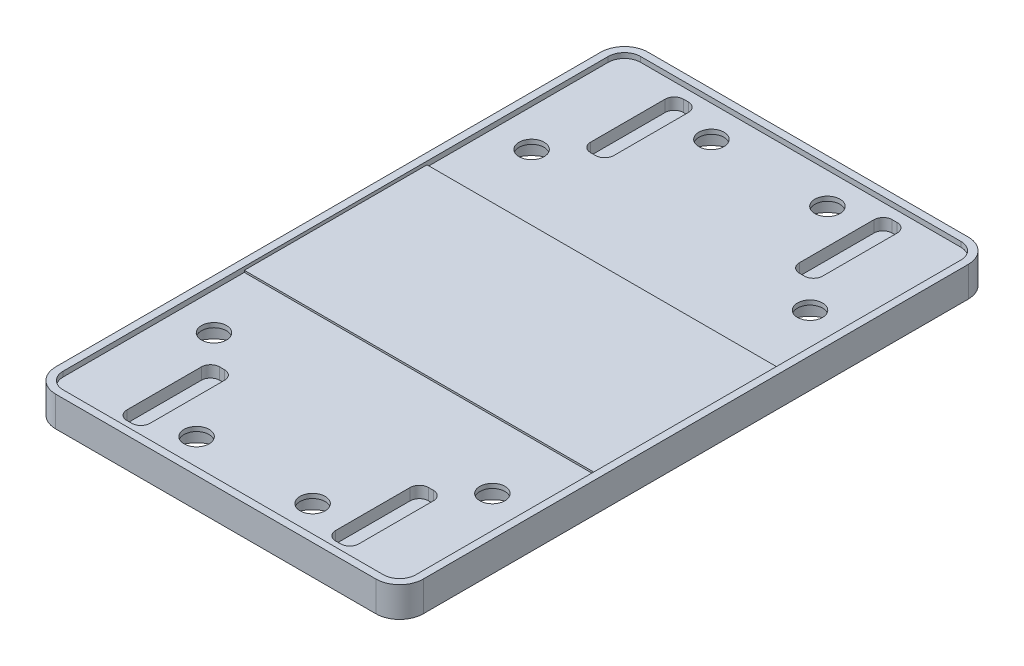
from build123d import *

# Parameters (mm, degrees)
SKETCH1_W             = 40.2336
SKETCH1_H             = 22.0218
BOSS_EXTRUDE1_DEPTH   = 3.3
FILLET1_R             = 2.5908
SKETCH3_W             = 38.608
SKETCH3_H             = 21.209
CUT_EXTRUDE1_DEPTH    = 0.5588
FILLET2_R             = 1.778
SKETCH4_R             = 1.375
CUT_EXTRUDE2_DEPTH    = 24.096314392
SKETCH5_R             = 3.045
CUT_EXTRUDE3_DEPTH    = 2.25
SKETCH6_W             = 2.54
SKETCH6_H             = 10.16
CUT_EXTRUDE4_DEPTH    = 1.27
FILLET3_R             = 1
FILLET3_OF_MIRROR3_R  = 1
BOSS_EXTRUDE2_DEPTH   = 20.8
SKETCH9_W             = 38.608
SKETCH9_H             = 20
BOSS_EXTRUDE3_DEPTH   = 0.2
MIRROR4_OUTLINE_R     = 3.045
MIRROR4_DEPTH         = 2.7412
MIRROR4_2_DEPTH       = 1.4712
MIRROR4_START         = 2.25
MIRROR4_3_OUTLINE_R   = 3.045
MIRROR4_3_OUTLINE_R_2 = 1.375
MIRROR4_3_DEPTH       = 0.4912
MIRROR4_START_2       = 2.7412
MIRROR4_4_DEPTH       = 0.5588


# Read off the part's stored shape, not the designer's step: Mirror4
with BuildPart() as part:
    # Sketch1 → Boss-Extrude1 (new body)
    with BuildSketch(Plane(origin=(0, 0, 0), x_dir=(1, 0, 0), z_dir=(0, 1, 0))):
        Rectangle(SKETCH1_W, SKETCH1_H)
    extrude(amount=BOSS_EXTRUDE1_DEPTH)

    # Fillet1
    fillet1_edges = [part.edges().sort_by_distance(p)[0] for p in [
        (-20.1168, 1.65, -11.0109),
        (20.1168, 1.65, -11.0109),
    ]]
    fillet(fillet1_edges, radius=FILLET1_R)

    # Sketch3 → Cut-Extrude1 (cut)
    with BuildSketch(Plane(origin=(0, 3.3, 0), x_dir=(1, 0, 0), z_dir=(0, 1, 0))):
        with Locations((0, -0.4064)):
            Rectangle(SKETCH3_W, SKETCH3_H)
    extrude(amount=-CUT_EXTRUDE1_DEPTH, mode=Mode.SUBTRACT)

    # Fillet2
    fillet2_edges = [part.edges().sort_by_distance(p)[0] for p in [
        (19.304, 3.0206, -10.1981),
        (-19.304, 3.0206, -10.1981),
    ]]
    fillet(fillet2_edges, radius=FILLET2_R)

    # Sketch4 → Cut-Extrude2 (cut, through all)
    with BuildSketch(Plane(origin=(0, 2.7412, 0), x_dir=(1, 0, 0), z_dir=(0, 1, 0))):
        with Locations(Location((-6.35, 6.7691, 0), (0, 0, 270))):
            Circle(SKETCH4_R)
        with Locations(Location((-15.24, -4.0259, 0), (0, 0, 270))):
            Circle(SKETCH4_R)
    cut_extrude2 = extrude(amount=-CUT_EXTRUDE2_DEPTH, mode=Mode.SUBTRACT)

    # Mirror1: Cut-Extrude2 across plane
    add(cut_extrude2.mirror(Plane(origin=(0, 0, 0), x_dir=(0, 0, 1), z_dir=(1, 0, 0))), mode=Mode.SUBTRACT)

    # Sketch5 → Cut-Extrude3 (cut)
    with BuildSketch(Plane.XZ):
        with Locations(Location((-15.24, 4.0259, 0), (0, 0, 270))):
            Circle(SKETCH5_R)
        with Locations(Location((-6.35, -6.7691, 0), (0, 0, 270))):
            Circle(SKETCH5_R)
    cut_extrude3 = extrude(amount=-CUT_EXTRUDE3_DEPTH, mode=Mode.SUBTRACT)

    # Mirror2: Cut-Extrude3 across plane
    add(cut_extrude3.mirror(Plane(origin=(0, 0, 0), x_dir=(0, 0, 1), z_dir=(1, 0, 0))), mode=Mode.SUBTRACT)

    # Sketch6 → Cut-Extrude4 (cut)
    with BuildSketch(Plane(origin=(0, 2.7412, 0), x_dir=(1, 0, 0), z_dir=(0, 1, 0))):
        with Locations((-11.43, 3.9751)):
            Rectangle(SKETCH6_W, SKETCH6_H)
    cut_extrude4 = extrude(amount=-CUT_EXTRUDE4_DEPTH, mode=Mode.SUBTRACT)

    # Fillet3
    fillet3_edges = [part.edges().sort_by_distance(p)[0] for p in [
        (-10.16, 2.1062, -9.0551),
        (-10.16, 2.1062, 1.1049),
        (-12.7, 2.1062, 1.1049),
        (-12.7, 2.1062, -9.0551),
    ]]
    fillet(fillet3_edges, radius=FILLET3_R)

    # Mirror3: Cut-Extrude4 across plane
    add(cut_extrude4.mirror(Plane(origin=(0, 0, 0), x_dir=(0, 0, 1), z_dir=(1, 0, 0))), mode=Mode.SUBTRACT)

    # Fillet3 of Mirror3
    fillet3_of_mirror3_edges = [part.edges().sort_by_distance(p)[0] for p in [
        (10.16, 2.1062, -9.0551),
        (10.16, 2.1062, 1.1049),
        (12.7, 2.1062, 1.1049),
        (12.7, 2.1062, -9.0551),
    ]]
    fillet(fillet3_of_mirror3_edges, radius=FILLET3_OF_MIRROR3_R)

    # Sketch8 → Boss-Extrude2 (add)
    with BuildSketch(Plane.XY.offset(11.0109)):
        Polygon((-20.1168, 0), (-20.1168, 3.3), (-19.304, 3.3), (-19.304, 2.7412), (19.304, 2.7412), (19.304, 3.3), (20.1168, 3.3), (20.1168, 0), align=None)
    extrude(amount=BOSS_EXTRUDE2_DEPTH)

    # Sketch9 → Boss-Extrude3 (add)
    with BuildSketch(Plane(origin=(0, 2.7412, 0), x_dir=(1, 0, 0), z_dir=(0, 1, 0))):
        with Locations((0, -21.4109)):
            Rectangle(SKETCH9_W, SKETCH9_H)
    extrude(amount=BOSS_EXTRUDE3_DEPTH)

    # Mirror4 outline → Mirror4 (add)
    with BuildSketch(Plane(origin=(0, 0, 0), x_dir=(1, 0, 0), z_dir=(0, 1, 0))):
        with BuildLine():
            Line((-20.1168, -31.8109), (-20.1168, -51.241899868))
            ThreePointArc((-20.1168, -51.241899868), (-19.357972249, -53.073872117), (-17.526, -53.832699868))
            Line((-17.526, -53.832699868), (17.526, -53.832699868))
            ThreePointArc((17.526, -53.832699868), (19.357972249, -53.073872117), (20.1168, -51.241899868))
            Line((20.1168, -51.241899868), (20.1168, -31.8109))
            Line((20.1168, -31.8109), (-20.1168, -31.8109))
        make_face()
        with Locations((-6.35, -49.590899868)):
            Circle(MIRROR4_OUTLINE_R, mode=Mode.SUBTRACT)
        with BuildLine():
            ThreePointArc((-11.16, -41.716899868), (-10.452893219, -42.009793087), (-10.16, -42.716899868))
            Line((-10.16, -42.716899868), (-10.16, -50.876899868))
            ThreePointArc((-10.16, -50.876899868), (-10.452893219, -51.584006649), (-11.16, -51.876899868))
            Line((-11.16, -51.876899868), (-11.7, -51.876899868))
            ThreePointArc((-11.7, -51.876899868), (-12.407106781, -51.584006649), (-12.7, -50.876899868))
            Line((-12.7, -50.876899868), (-12.7, -42.716899868))
            ThreePointArc((-12.7, -42.716899868), (-12.407106781, -42.009793087), (-11.7, -41.716899868))
            Line((-11.7, -41.716899868), (-11.16, -41.716899868))
        make_face(mode=Mode.SUBTRACT)
        with Locations((6.35, -49.590899868)):
            Circle(MIRROR4_OUTLINE_R, mode=Mode.SUBTRACT)
        with BuildLine():
            Line((10.16, -50.876899868), (10.16, -42.716899868))
            ThreePointArc((10.16, -42.716899868), (10.452893219, -42.009793087), (11.16, -41.716899868))
            Line((11.16, -41.716899868), (11.7, -41.716899868))
            ThreePointArc((11.7, -41.716899868), (12.407106781, -42.009793087), (12.7, -42.716899868))
            Line((12.7, -42.716899868), (12.7, -50.876899868))
            ThreePointArc((12.7, -50.876899868), (12.407106781, -51.584006649), (11.7, -51.876899868))
            Line((11.7, -51.876899868), (11.16, -51.876899868))
            ThreePointArc((11.16, -51.876899868), (10.452893219, -51.584006649), (10.16, -50.876899868))
        make_face(mode=Mode.SUBTRACT)
        with Locations((-15.24, -38.795899868)):
            Circle(MIRROR4_OUTLINE_R, mode=Mode.SUBTRACT)
        with Locations((15.24, -38.795899868)):
            Circle(MIRROR4_OUTLINE_R, mode=Mode.SUBTRACT)
    extrude(amount=MIRROR4_DEPTH)

    # Mirror4 2 outline → Mirror4 2 (add)
    with BuildSketch(Plane(origin=(0, 0, 0), x_dir=(1, 0, 0), z_dir=(0, 1, 0))):
        with BuildLine():
            Line((-10.16, -50.876899868), (-10.16, -42.716899868))
            ThreePointArc((-10.16, -42.716899868), (-10.452893219, -42.009793087), (-11.16, -41.716899868))
            Line((-11.16, -41.716899868), (-11.7, -41.716899868))
            ThreePointArc((-11.7, -41.716899868), (-12.407106781, -42.009793087), (-12.7, -42.716899868))
            Line((-12.7, -42.716899868), (-12.7, -50.876899868))
            ThreePointArc((-12.7, -50.876899868), (-12.407106781, -51.584006649), (-11.7, -51.876899868))
            Line((-11.7, -51.876899868), (-11.16, -51.876899868))
            ThreePointArc((-11.16, -51.876899868), (-10.452893219, -51.584006649), (-10.16, -50.876899868))
        make_face()
        with BuildLine():
            ThreePointArc((11.16, -41.716899868), (10.452893219, -42.009793087), (10.16, -42.716899868))
            Line((10.16, -42.716899868), (10.16, -50.876899868))
            ThreePointArc((10.16, -50.876899868), (10.452893219, -51.584006649), (11.16, -51.876899868))
            Line((11.16, -51.876899868), (11.7, -51.876899868))
            ThreePointArc((11.7, -51.876899868), (12.407106781, -51.584006649), (12.7, -50.876899868))
            Line((12.7, -50.876899868), (12.7, -42.716899868))
            ThreePointArc((12.7, -42.716899868), (12.407106781, -42.009793087), (11.7, -41.716899868))
            Line((11.7, -41.716899868), (11.16, -41.716899868))
        make_face()
    extrude(amount=MIRROR4_2_DEPTH)

    # Mirror4 3 outline → Mirror4 3 (add)
    # profile 1 of 4: a face of its own
    with BuildSketch(Plane(origin=(0, 0, 0), x_dir=(1, 0, 0), z_dir=(0, 1, 0)).offset(MIRROR4_START)):
        with Locations((-6.35, -49.590899868)):
            Circle(MIRROR4_3_OUTLINE_R)
        with Locations((-6.35, -49.590899868)):
            Circle(MIRROR4_3_OUTLINE_R_2, mode=Mode.SUBTRACT)
    # profile 2 of 4: a face of its own
    with BuildSketch(Plane(origin=(0, 0, 0), x_dir=(1, 0, 0), z_dir=(0, 1, 0)).offset(MIRROR4_START)):
        with Locations((-15.24, -38.795899868)):
            Circle(MIRROR4_3_OUTLINE_R)
        with Locations((-15.24, -38.795899868)):
            Circle(MIRROR4_3_OUTLINE_R_2, mode=Mode.SUBTRACT)
    # profile 3 of 4: a face of its own
    with BuildSketch(Plane(origin=(0, 0, 0), x_dir=(1, 0, 0), z_dir=(0, 1, 0)).offset(MIRROR4_START)):
        with Locations((6.35, -49.590899868)):
            Circle(MIRROR4_3_OUTLINE_R)
        with Locations((6.35, -49.590899868)):
            Circle(MIRROR4_3_OUTLINE_R_2, mode=Mode.SUBTRACT)
    # profile 4 of 4: a face of its own
    with BuildSketch(Plane(origin=(0, 0, 0), x_dir=(1, 0, 0), z_dir=(0, 1, 0)).offset(MIRROR4_START)):
        with Locations((15.24, -38.795899868)):
            Circle(MIRROR4_3_OUTLINE_R)
        with Locations((15.24, -38.795899868)):
            Circle(MIRROR4_3_OUTLINE_R_2, mode=Mode.SUBTRACT)
    extrude(amount=MIRROR4_3_DEPTH)

    # Mirror4 4 outline → Mirror4 4 (add)
    with BuildSketch(Plane(origin=(0, 0, 0), x_dir=(1, 0, 0), z_dir=(0, 1, 0)).offset(MIRROR4_START_2)):
        with BuildLine():
            Line((19.304, -31.8109), (19.304, -51.241899868))
            ThreePointArc((19.304, -51.241899868), (18.783235857, -52.499135725), (17.526, -53.019899868))
            Line((17.526, -53.019899868), (-17.526, -53.019899868))
            ThreePointArc((-17.526, -53.019899868), (-18.783235857, -52.499135725), (-19.304, -51.241899868))
            Line((-19.304, -51.241899868), (-19.304, -31.8109))
            Line((-19.304, -31.8109), (-20.1168, -31.8109))
            Line((-20.1168, -31.8109), (-20.1168, -51.241899868))
            ThreePointArc((-20.1168, -51.241899868), (-19.357972249, -53.073872117), (-17.526, -53.832699868))
            Line((-17.526, -53.832699868), (17.526, -53.832699868))
            ThreePointArc((17.526, -53.832699868), (19.357972249, -53.073872117), (20.1168, -51.241899868))
            Line((20.1168, -51.241899868), (20.1168, -31.8109))
            Line((20.1168, -31.8109), (19.304, -31.8109))
        make_face()
    extrude(amount=MIRROR4_4_DEPTH)


solid = part.part
